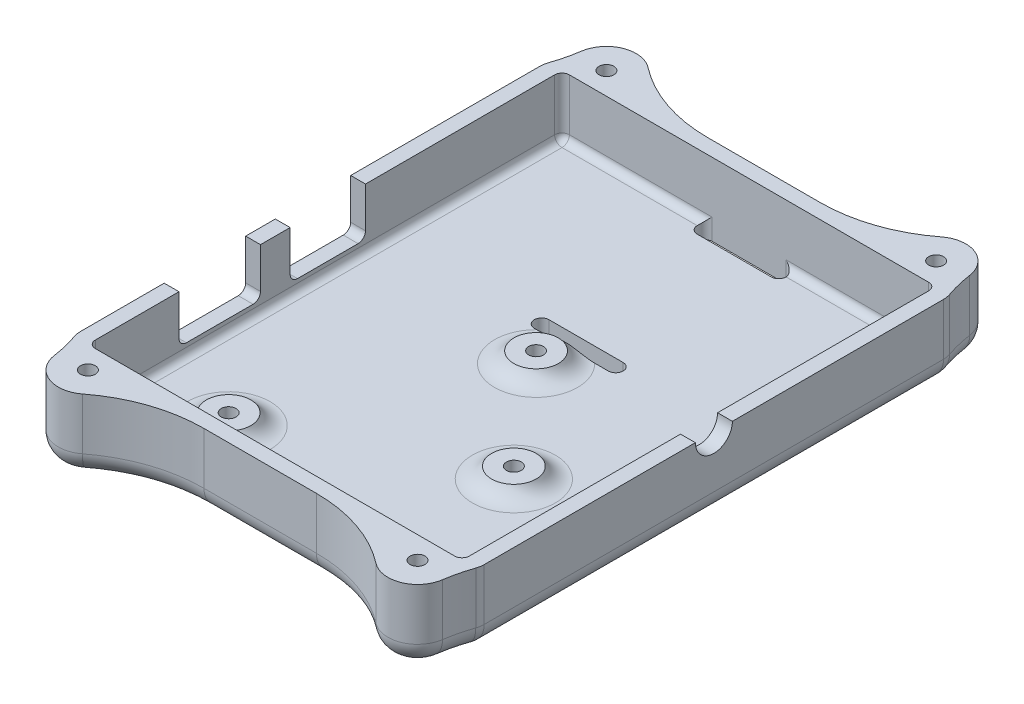
from build123d import *

# Parameters (mm, degrees)
SKETCH1_R           = 1.0000000000000018
SKETCH1_R_2         = 1
CASING_BOTTOM_DEPTH = 2
CASING_WALLS_DEPTH  = 8
FILLET1_R           = 1
BOSS_EXTRUDE3_START = -10
SKETCH3_R           = 0.9999999999999983
SKETCH3_R_2         = 1.0000000000000018
BOSS_EXTRUDE3_DEPTH = 10
FILLET2_R           = 20
FILLET3_R           = 3
SKETCH5_R           = 3.0000000000000027
SKETCH5_R_2         = 1.0000000000000018
SKETCH5_R_3         = 3
SKETCH5_R_4         = 1
BOSS_EXTRUDE4_DEPTH = 1.5
FILLET4_R           = 3
SKETCH6_W           = 10.174002270500015
SKETCH6_H           = 8
CUT_EXTRUDE2_DEPTH  = 2
FILLET5_R           = 1
CUT_EXTRUDE3_DEPTH  = 2


with BuildPart() as part:
    # Sketch1 → Casing bottom (new body)
    with BuildSketch(Plane(origin=(0, 0, 0), x_dir=(1, 0, 0), z_dir=(0, 1, 0))):
        with BuildLine():
            Line((-35.500000000000014, 45.000000000000014), (13.00000000000001, 45.000000000000014))
            ThreePointArc((13.00000000000001, 45.000000000000014), (15.121320343559663, 44.12132034355965), (16.000000000000014, 42))
            Line((16.000000000000014, 42), (16.000000000000007, -19.999999999999996))
            ThreePointArc((16.000000000000007, -19.999999999999996), (15.121320343559653, -22.121320343559645), (13.000000000000005, -23.000000000000004))
            Line((13.000000000000005, -23.000000000000004), (-35.50000000000001, -23.000000000000004))
            ThreePointArc((-35.50000000000001, -23.000000000000004), (-37.62132034355965, -22.12132034355964), (-38.50000000000001, -19.999999999999996))
            Line((-38.50000000000001, -19.999999999999996), (-38.500000000000014, 42))
            ThreePointArc((-38.500000000000014, 42), (-37.62132034355967, 44.12132034355965), (-35.500000000000014, 45.000000000000014))
        make_face()
        with Locations(Location((-25.500000000000004, -13.000000000000002, 0), (0, 0, 270))):
            Circle(SKETCH1_R, mode=Mode.SUBTRACT)
        with Locations(Location((0, 0, 0), (0, 0, 270))):
            Circle(SKETCH1_R_2, mode=Mode.SUBTRACT)
        with Locations(Location((-12, 15, 0), (0, 0, 270))):
            Circle(SKETCH1_R, mode=Mode.SUBTRACT)
        with BuildLine():
            Line((-16.249999999999996, 21.000000000000007), (-6.249999999999996, 21.000000000000007))
            ThreePointArc((-6.249999999999996, 21.000000000000007), (-5.249999999999996, 20.000000000000007), (-6.249999999999996, 19.000000000000007))
            Line((-6.249999999999996, 19.000000000000007), (-16.249999999999996, 19.000000000000007))
            ThreePointArc((-16.249999999999996, 19.000000000000007), (-17.249999999999996, 20.000000000000007), (-16.249999999999996, 21.000000000000007))
        make_face(mode=Mode.SUBTRACT)
        with BuildLine():
            Line((-16.249999999999996, 43.00000000000001), (-6.249999999999996, 43.00000000000001))
            ThreePointArc((-6.249999999999996, 43.00000000000001), (-5.249999999999996, 42.00000000000001), (-6.249999999999996, 41.00000000000001))
            Line((-6.249999999999996, 41.00000000000001), (-16.249999999999996, 41.00000000000001))
            ThreePointArc((-16.249999999999996, 41.00000000000001), (-17.249999999999996, 42.00000000000001), (-16.249999999999996, 43.00000000000001))
        make_face(mode=Mode.SUBTRACT)
    extrude(amount=CASING_BOTTOM_DEPTH)

    # Sketch2 → Casing walls (add)
    with BuildSketch(Plane(origin=(0, 2, 0), x_dir=(1, 0, 0), z_dir=(0, 1, 0))):
        with BuildLine():
            Line((16.000000000000007, -19.999999999999996), (16.000000000000014, 42))
            ThreePointArc((16.000000000000014, 42), (15.121320343559656, 44.121320343559645), (13.00000000000001, 45.000000000000014))
            Line((13.00000000000001, 45.000000000000014), (-35.500000000000014, 45.000000000000014))
            ThreePointArc((-35.500000000000014, 45.000000000000014), (-37.62132034355967, 44.12132034355965), (-38.50000000000002, 42))
            Line((-38.50000000000002, 42), (-38.50000000000001, -19.999999999999996))
            ThreePointArc((-38.50000000000001, -19.999999999999996), (-37.62132034355965, -22.12132034355964), (-35.50000000000001, -23))
            Line((-35.50000000000001, -23), (13.000000000000005, -23.000000000000004))
            ThreePointArc((13.000000000000005, -23.000000000000004), (15.121320343559653, -22.121320343559645), (16.000000000000007, -19.999999999999996))
        make_face()
        with BuildLine():
            ThreePointArc((-36.5, -19.999999999999996), (-36.20710678118655, -20.70710678118654), (-35.50000000000001, -20.999999999999996))
            Line((-35.50000000000001, -20.999999999999996), (13.000000000000009, -20.999999999999996))
            ThreePointArc((13.000000000000009, -20.999999999999996), (13.707106781186557, -20.707106781186543), (14.000000000000007, -19.999999999999996))
            Line((14.000000000000007, -19.999999999999996), (14.000000000000007, 42.00000000000001))
            ThreePointArc((14.000000000000007, 42.00000000000001), (13.707106781186555, 42.70710678118655), (13.000000000000009, 43.00000000000001))
            Line((13.000000000000009, 43.00000000000001), (-35.500000000000014, 43))
            ThreePointArc((-35.500000000000014, 43), (-36.20710678118657, 42.70710678118655), (-36.50000000000002, 42))
            Line((-36.50000000000002, 42), (-36.5, -19.999999999999996))
        make_face(mode=Mode.SUBTRACT)
    extrude(amount=CASING_WALLS_DEPTH)

    # Fillet1
    fillet1_edges = [part.edges().sort_by_distance(p)[0] for p in [
        (-25.875000000000007, 2, -43),
        (-36.20710678118657, 2, -42.70710678118655),
        (-36.20710678118655, 2, 20.707106781186543),
        (-11.25, 2, 20.999999999999996),
        (13.707106781186557, 2, 20.707106781186543),
        (14.000000000000007, 2, -11.000000000000004),
        (13.707106781186555, 2, -42.70710678118655),
        (3.375000000000007, 2, -43.00000000000001),
        (-36.500000000000014, 2, -11),
    ]]
    fillet(fillet1_edges, radius=FILLET1_R)

    # Sketch3 → Boss-Extrude3 (add)
    # profile 1 of 4: a face of its own
    with BuildSketch(Plane(origin=(0, 10, 0), x_dir=(1, 0, 0), z_dir=(0, 1, 0)).offset(BOSS_EXTRUDE3_START)):
        with BuildLine():
            Line((-35.500000000000014, 43), (-30.854248688935428, 43.00000000000001))
            ThreePointArc((-30.854248688935428, 43.00000000000001), (-33.600556679704695, 49.998735844509724), (-35.99161984870957, 42.87080992435478))
            ThreePointArc((-35.99161984870957, 42.87080992435478), (-35.75415553864241, 42.96716335857879), (-35.500000000000014, 43))
        make_face()
        with Locations(Location((-33.500000000000014, 46.000000000000014, 0), (0, 0, 270))):
            Circle(SKETCH3_R, mode=Mode.SUBTRACT)
    # profile 2 of 4: a face of its own
    with BuildSketch(Plane(origin=(0, 10, 0), x_dir=(1, 0, 0), z_dir=(0, 1, 0)).offset(BOSS_EXTRUDE3_START)):
        with BuildLine():
            Line((8.35424868893541, 43.00000000000001), (13.000000000000009, 43.00000000000001))
            ThreePointArc((13.000000000000009, 43.00000000000001), (13.25415553864241, 42.96716335857878), (13.491619848709576, 42.87080992435478))
            ThreePointArc((13.491619848709576, 42.87080992435478), (11.100556679704688, 49.998735844509724), (8.35424868893541, 43.00000000000001))
        make_face()
        with Locations(Location((11.000000000000007, 46.00000000000001, 0), (0, 0, 270))):
            Circle(SKETCH3_R_2, mode=Mode.SUBTRACT)
    # profile 3 of 4: a face of its own
    with BuildSketch(Plane(origin=(0, 10, 0), x_dir=(1, 0, 0), z_dir=(0, 1, 0)).offset(BOSS_EXTRUDE3_START)):
        with BuildLine():
            Line((8.35424868893541, -21.000000000000004), (13.000000000000009, -21.000000000000004))
            ThreePointArc((13.000000000000009, -21.000000000000004), (13.254155538642408, -20.967163358578787), (13.491619848709576, -20.870809924354788))
            ThreePointArc((13.491619848709576, -20.870809924354788), (11.100556679704685, -27.998735844509707), (8.35424868893541, -21.000000000000004))
        make_face()
        with Locations(Location((11.000000000000007, -24, 0), (0, 0, 90))):
            Circle(SKETCH3_R_2, mode=Mode.SUBTRACT)
    # profile 4 of 4: a face of its own
    with BuildSketch(Plane(origin=(0, 10, 0), x_dir=(1, 0, 0), z_dir=(0, 1, 0)).offset(BOSS_EXTRUDE3_START)):
        with BuildLine():
            Line((-35.500000000000014, -20.999999999999996), (-30.854248688935428, -21.000000000000004))
            ThreePointArc((-30.854248688935428, -21.000000000000004), (-33.600556679704695, -27.998735844509717), (-35.99161984870957, -20.870809924354788))
            ThreePointArc((-35.99161984870957, -20.870809924354788), (-35.75415553864241, -20.96716335857878), (-35.500000000000014, -20.999999999999996))
        make_face()
        with Locations(Location((-33.500000000000014, -24.000000000000007, 0), (0, 0, 90))):
            Circle(SKETCH3_R, mode=Mode.SUBTRACT)
    extrude(amount=BOSS_EXTRUDE3_DEPTH)

    # Fillet2
    fillet2_edges = [part.edges().sort_by_distance(p)[0] for p in [
        (-29.627016653792595, 5, -45.000000000000014),
        (-37.19733891886112, 5, -44.47366945943057),
        (14.69733891886112, 5, -44.47366945943056),
        (7.127016653792585, 5, -45.000000000000014),
        (7.127016653792586, 5, 23.000000000000004),
        (14.697338918861105, 5, 22.473669459430557),
        (-37.19733891886111, 5, 22.47366945943055),
        (-29.6270166537926, 5, 23.000000000000004),
    ]]
    fillet(fillet2_edges, radius=FILLET2_R)

    # Fillet3
    # the kernel refuses this fillet: 3 mm, written as the material it takes off along each edge
    with BuildSketch(Plane(origin=(-18.83712170138482, 0, 43), x_dir=(-0.6109532624423001, 0, -0.791666666666666), z_dir=(-0.791666666666666, 0, 0.6109532624423001))) as fillet3_piece_1:
        with BuildLine():
            CenterArc((20.000000000000004 + FILLET3_R, -FILLET3_R), FILLET3_R, 90, 90)
            Line((20.000000000000007, -FILLET3_R), (20.000000000000004, 0))
            Line((20.000000000000004, 0), (20.000000000000004 + FILLET3_R, 0))
        make_face()
    revolve(axis=Axis((-18.83712170138482, 0, 43), (0, -1, 0)), revolution_arc=37.658462006207905, mode=Mode.SUBTRACT)
    with BuildSketch(Plane(origin=(-33.500000000000014, 0, 24.00000000000001), x_dir=(0.6109532624422995, 0, 0.7916666666666664), z_dir=(0.7916666666666664, 0, -0.6109532624422995))) as fillet3_piece_2:
        with BuildLine():
            CenterArc((3.9999999999999982 - FILLET3_R, -FILLET3_R), FILLET3_R, 8.48e-15, 90)
            Line((3.9999999999999982, -FILLET3_R), (3.9999999999999982, 0))
            Line((3.9999999999999982, 0), (3.9999999999999982 - FILLET3_R, 0))
        make_face()
    revolve(axis=Axis((-33.500000000000014, 0, 24.00000000000001), (0, -1, 0)), revolution_arc=119.28031754414539, mode=Mode.SUBTRACT)
    with BuildSketch(Plane(origin=(-57.24387307605734, 0, 27.496936167148185), x_dir=(0.9453857252310887, 0, -0.32595372452127086), z_dir=(-0.32595372452127086, 0, -0.9453857252310887))) as fillet3_piece_3:
        with BuildLine():
            CenterArc((20.00000148352137 + FILLET3_R * 1.00000000214, -FILLET3_R), FILLET3_R, 90, 89.99999999999997)
            Line((20.00000148352137 + FILLET3_R * 2.14146922417e-09, -FILLET3_R), (20.00000148352137, 0))
            Line((20.00000148352137, 0), (20.00000148352137 + FILLET3_R * 1.00000000214, 0))
        make_face()
    revolve(axis=Axis((-57.24387307605734, 0, 27.496936167148185), (0, -1, 0)), revolution_arc=10.645221250007552, mode=Mode.SUBTRACT)
    with BuildSketch(Plane(origin=(-35.5, 0, 19.999999999999993), x_dir=(-0.9453857229785418, 0, 0.32595373105448533), z_dir=(0.32595373105448533, 0, 0.9453857229785418))) as fillet3_piece_4:
        with BuildLine():
            CenterArc((3.0000000000000036 - FILLET3_R, -FILLET3_R), FILLET3_R, 8.48e-15, 90)
            Line((3.0000000000000036, -FILLET3_R), (3.0000000000000036, 0))
            Line((3.0000000000000036, 0), (3.0000000000000036 - FILLET3_R, 0))
        make_face()
    revolve(axis=Axis((-35.5, 0, 19.999999999999993), (0, -1, 0)), revolution_arc=19.023366503969896, mode=Mode.SUBTRACT)
    with BuildSketch(Plane(origin=(-38.50000000000001, 0, 19.999999999999996), x_dir=(1, 0, -1.1e-16), z_dir=(-1.1e-16, 0, -1))) as fillet3_piece_5:
        with BuildLine():
            CenterArc((FILLET3_R, -FILLET3_R), FILLET3_R, 90, 90)
            Line((0, -FILLET3_R), (0, 0))
            Line((0, 0), (FILLET3_R, 0))
        make_face()
    extrude(amount=62, mode=Mode.SUBTRACT)
    with BuildSketch(Plane(origin=(-35.50000000000003, 0, -42.00000000000003), x_dir=(-1, 0, 9.47e-15), z_dir=(9.47e-15, 0, 1))) as fillet3_piece_6:
        with BuildLine():
            CenterArc((2.999999999999986 - FILLET3_R, -FILLET3_R), FILLET3_R, 8.48e-15, 90)
            Line((2.999999999999986, -FILLET3_R), (2.999999999999986, 0))
            Line((2.999999999999986, 0), (2.999999999999986 - FILLET3_R, 0))
        make_face()
    revolve(axis=Axis((-35.50000000000003, 0, -42.00000000000003), (0, -1, 0)), revolution_arc=19.023366503970635, mode=Mode.SUBTRACT)
    with BuildSketch(Plane(origin=(-57.243873076059, 0, -49.49693616714876), x_dir=(0.9893279835141823, 0, 0.14570566576410793), z_dir=(0.14570566576410793, 0, -0.9893279835141823))) as fillet3_piece_7:
        with BuildLine():
            CenterArc((20.000001483523118 + FILLET3_R * 1.00000000214, -FILLET3_R), FILLET3_R, 90, 90)
            Line((20.000001483523118 + FILLET3_R * 2.14147277688e-09, -FILLET3_R), (20.000001483523118, 0))
            Line((20.000001483523118, 0), (20.000001483523118 + FILLET3_R * 1.00000000214, 0))
        make_face()
    revolve(axis=Axis((-57.243873076059, 0, -49.49693616714876), (0, -1, 0)), revolution_arc=10.645221250006543, mode=Mode.SUBTRACT)
    with BuildSketch(Plane(origin=(-33.500000000000014, 0, -46.00000000000001), x_dir=(0.6109532624422982, 0, -0.7916666666666675), z_dir=(0.7916666666666675, 0, 0.6109532624422982))) as fillet3_piece_8:
        with BuildLine():
            CenterArc((4 - FILLET3_R, FILLET3_R), FILLET3_R, 270, 89.99999999999999)
            Line((4, FILLET3_R), (4, 0))
            Line((4, 0), (4 - FILLET3_R, 0))
        make_face()
    revolve(axis=Axis((-33.500000000000014, 0, -46.00000000000001), (0, 1, 0)), revolution_arc=119.28031754414503, mode=Mode.SUBTRACT)
    with BuildSketch(Plane(origin=(-18.837121701384845, 0, -65.00000000000001), x_dir=(1.8e-16, 0, 1), z_dir=(1, 0, -1.8e-16))) as fillet3_piece_9:
        with BuildLine():
            CenterArc((19.999999999999993 + FILLET3_R, -FILLET3_R), FILLET3_R, 90, 90)
            Line((20, -FILLET3_R), (19.999999999999993, 0))
            Line((19.999999999999993, 0), (19.999999999999993 + FILLET3_R, 0))
        make_face()
    revolve(axis=Axis((-18.837121701384845, 0, -65.00000000000001), (0, -1, 0)), revolution_arc=37.658462006207806, mode=Mode.SUBTRACT)
    with BuildSketch(Plane(origin=(-18.837121701384845, 0, -45.000000000000014), x_dir=(0, 0, 1), z_dir=(1, 0, 0))) as fillet3_piece_10:
        with BuildLine():
            CenterArc((FILLET3_R, -FILLET3_R), FILLET3_R, 90, 90)
            Line((0, -FILLET3_R), (0, 0))
            Line((0, 0), (FILLET3_R, 0))
        make_face()
    extrude(amount=15.174243402769676, mode=Mode.SUBTRACT)
    with BuildSketch(Plane(origin=(-3.662878298615171, 0, -65.00000000000001), x_dir=(0.610953262442299, 0, 0.7916666666666667), z_dir=(0.7916666666666667, 0, -0.610953262442299))) as fillet3_piece_11:
        with BuildLine():
            CenterArc((19.999999999999996 + FILLET3_R, -FILLET3_R), FILLET3_R, 90, 90)
            Line((20.00000000000001, -FILLET3_R), (19.999999999999996, 0))
            Line((19.999999999999996, 0), (19.999999999999996 + FILLET3_R, 0))
        make_face()
    revolve(axis=Axis((-3.662878298615171, 0, -65.00000000000001), (0, -1, 0)), revolution_arc=37.65846200620783, mode=Mode.SUBTRACT)
    with BuildSketch(Plane(origin=(11.00000000000001, 0, -46.00000000000001), x_dir=(0.9893279845211018, 0, -0.14570565892721785), z_dir=(0.14570565892721785, 0, 0.9893279845211018))) as fillet3_piece_12:
        with BuildLine():
            CenterArc((4.000000000000008 - FILLET3_R, FILLET3_R), FILLET3_R, 270, 89.99999999999999)
            Line((4.0000000000000036, FILLET3_R), (4.000000000000008, 0))
            Line((4.000000000000008, 0), (4.000000000000008 - FILLET3_R, 0))
        make_face()
    revolve(axis=Axis((11.00000000000001, 0, -46.00000000000001), (0, 1, 0)), revolution_arc=119.28031754414513, mode=Mode.SUBTRACT)
    with BuildSketch(Plane(origin=(34.74387307606069, 0, -49.49693616714912), x_dir=(-0.9453857252310925, 0, 0.32595372452125976), z_dir=(0.32595372452125976, 0, 0.9453857252310925))) as fillet3_piece_13:
        with BuildLine():
            CenterArc((20.000001483524827 + FILLET3_R * 1.00000000214, -FILLET3_R), FILLET3_R, 90, 90)
            Line((20.000001483524827 + FILLET3_R * 2.14147277688e-09, -FILLET3_R), (20.000001483524827, 0))
            Line((20.000001483524827, 0), (20.000001483524827 + FILLET3_R * 1.00000000214, 0))
        make_face()
    revolve(axis=Axis((34.74387307606069, 0, -49.49693616714912), (0, -1, 0)), revolution_arc=10.645221250005626, mode=Mode.SUBTRACT)
    with BuildSketch(Plane(origin=(13.000000000000021, 0, -42.00000000000002), x_dir=(0.9453857229785415, 0, -0.32595373105448605), z_dir=(-0.32595373105448605, 0, -0.9453857229785415))) as fillet3_piece_14:
        with BuildLine():
            CenterArc((2.9999999999999925 - FILLET3_R, -FILLET3_R), FILLET3_R, 8.48e-15, 90)
            Line((2.9999999999999925, -FILLET3_R), (2.9999999999999925, 0))
            Line((2.9999999999999925, 0), (2.9999999999999925 - FILLET3_R, 0))
        make_face()
    revolve(axis=Axis((13.000000000000021, 0, -42.00000000000002), (0, -1, 0)), revolution_arc=19.023366503970404, mode=Mode.SUBTRACT)
    with BuildSketch(Plane(origin=(16.000000000000014, 0, -42), x_dir=(-1, 0, -1.1e-16), z_dir=(-1.1e-16, 0, 1))) as fillet3_piece_15:
        with BuildLine():
            CenterArc((FILLET3_R, -FILLET3_R), FILLET3_R, 90, 90)
            Line((0, -FILLET3_R), (0, 0))
            Line((0, 0), (FILLET3_R, 0))
        make_face()
    extrude(amount=62, mode=Mode.SUBTRACT)
    with BuildSketch(Plane(origin=(13.000000000000014, 0, 20.000000000000007), x_dir=(1, 0, -3.55e-15), z_dir=(-3.55e-15, 0, -1))) as fillet3_piece_16:
        with BuildLine():
            CenterArc((2.9999999999999964 - FILLET3_R, -FILLET3_R), FILLET3_R, 8.48e-15, 90)
            Line((2.9999999999999964, -FILLET3_R), (2.9999999999999964, 0))
            Line((2.9999999999999964, 0), (2.9999999999999964 - FILLET3_R, 0))
        make_face()
    revolve(axis=Axis((13.000000000000014, 0, 20.000000000000007), (0, -1, 0)), revolution_arc=19.023366503970454, mode=Mode.SUBTRACT)
    with BuildSketch(Plane(origin=(34.74387307605885, 0, 27.496936167148768), x_dir=(-0.989327983514182, 0, -0.14570566576410904), z_dir=(-0.14570566576410904, 0, 0.989327983514182))) as fillet3_piece_17:
        with BuildLine():
            CenterArc((20.000001483522976 + FILLET3_R * 1.00000000214, -FILLET3_R), FILLET3_R, 90, 90)
            Line((20.000001483522976 + FILLET3_R * 2.14147040841e-09, -FILLET3_R), (20.000001483522976, 0))
            Line((20.000001483522976, 0), (20.000001483522976 + FILLET3_R * 1.00000000214, 0))
        make_face()
    revolve(axis=Axis((34.74387307605885, 0, 27.496936167148768), (0, -1, 0)), revolution_arc=10.645221250006648, mode=Mode.SUBTRACT)
    with BuildSketch(Plane(origin=(11.000000000000002, 0, 24), x_dir=(0.9893279845211012, 0, 0.14570565892722168), z_dir=(0.14570565892722168, 0, -0.9893279845211012))) as fillet3_piece_18:
        with BuildLine():
            CenterArc((3.999999999999997 - FILLET3_R, -FILLET3_R), FILLET3_R, 8.48e-15, 90)
            Line((3.9999999999999987, -FILLET3_R), (3.999999999999997, 0))
            Line((3.999999999999997, 0), (3.999999999999997 - FILLET3_R, 0))
        make_face()
    revolve(axis=Axis((11.000000000000002, 0, 24), (0, -1, 0)), revolution_arc=119.280317544145, mode=Mode.SUBTRACT)
    with BuildSketch(Plane(origin=(-3.662878298615178, 0, 43), x_dir=(0, 0, -1), z_dir=(-1, 0, 0))) as fillet3_piece_19:
        with BuildLine():
            CenterArc((20 + FILLET3_R, -FILLET3_R), FILLET3_R, 90, 90)
            Line((20, -FILLET3_R), (20, 0))
            Line((20, 0), (20 + FILLET3_R, 0))
        make_face()
    revolve(axis=Axis((-3.662878298615178, 0, 43), (0, -1, 0)), revolution_arc=37.65846200620784, mode=Mode.SUBTRACT)
    with BuildSketch(Plane(origin=(-3.662878298615178, 0, 23.000000000000004), x_dir=(0, 0, -1), z_dir=(-1, 0, 0))) as fillet3_piece_20:
        with BuildLine():
            CenterArc((FILLET3_R, -FILLET3_R), FILLET3_R, 90, 90)
            Line((0, -FILLET3_R), (0, 0))
            Line((0, 0), (FILLET3_R, 0))
        make_face()
    extrude(amount=15.174243402769639, mode=Mode.SUBTRACT)

    # Sketch5 → Boss-Extrude4 (add)
    # profile 1 of 3: a face of its own
    with BuildSketch(Plane(origin=(0, 2, 0), x_dir=(1, 0, 0), z_dir=(0, 1, 0))):
        with Locations(Location((-25.500000000000004, -13.000000000000002, 0), (0, 0, 90))):
            Circle(SKETCH5_R)
        with Locations(Location((-25.500000000000004, -13.000000000000002, 0), (0, 0, 270))):
            Circle(SKETCH5_R_2, mode=Mode.SUBTRACT)
    # profile 2 of 3: a face of its own
    with BuildSketch(Plane(origin=(0, 2, 0), x_dir=(1, 0, 0), z_dir=(0, 1, 0))):
        with Locations(Location((0, 0, 0), (0, 0, 90))):
            Circle(SKETCH5_R_3)
        with Locations(Location((0, 0, 0), (0, 0, 270))):
            Circle(SKETCH5_R_4, mode=Mode.SUBTRACT)
    # profile 3 of 3: a face of its own
    with BuildSketch(Plane(origin=(0, 2, 0), x_dir=(1, 0, 0), z_dir=(0, 1, 0))):
        with Locations(Location((-12, 15, 0), (0, 0, 90))):
            Circle(SKETCH5_R)
        with Locations(Location((-12, 15, 0), (0, 0, 270))):
            Circle(SKETCH5_R_2, mode=Mode.SUBTRACT)
    extrude(amount=BOSS_EXTRUDE4_DEPTH)

    # Fillet4
    # the kernel refuses this fillet: 3 mm, written as the material it adds along each edge
    with BuildSketch(Plane(origin=(-25.500000000000004, 2, 13.000000000000002), x_dir=(0, 0, -1), z_dir=(1, 0, 0))) as fillet4_piece_1:
        with BuildLine():
            CenterArc((5.5980762113534634, 3), FILLET4_R, 209.9999999999986, 60.000000000001364)
            Line((3.000000000000112, 1.500000000000063), (2.9480384757730445, 1.4700000000000641))
            ThreePointArc((2.9480384757730445, 1.4700000000000641), (2.9400000000000013, 0.7500000000000315), (2.9400000000000013, 0))
            Line((2.9400000000000013, 0), (3.0000000000000018, -0.06000000000000005))
            Line((3.0000000000000018, -0.06000000000000005), (5.5980762113534634, -0.06000000000000005))
            Line((5.5980762113534634, -0.06000000000000005), (5.5980762113534634, 0))
        make_face()
    revolve(axis=Axis((-25.500000000000004, 2, 13.000000000000002), (0, 1, 0)))
    with BuildSketch(Plane(origin=(0, 2, 0), x_dir=(6e-17, 0, -1), z_dir=(1, 0, 6e-17))) as fillet4_piece_2:
        with BuildLine():
            CenterArc((5.598076211353462, 3), FILLET4_R, 209.99999999999858, 60.00000000000142)
            Line((3.0000000000001092, 1.500000000000063), (2.9480384757730422, 1.4700000000000641))
            ThreePointArc((2.9480384757730422, 1.4700000000000641), (2.94, 0.7500000000000315), (2.94, 0))
            Line((2.94, 0), (3, -0.06000000000000005))
            Line((3, -0.06000000000000005), (5.598076211353462, -0.06000000000000005))
            Line((5.598076211353462, -0.06000000000000005), (5.598076211353462, 0))
        make_face()
    revolve(axis=Axis((0, 2, 0), (0, 1, 0)))
    with BuildSketch(Plane(origin=(-12, 2, -15), x_dir=(0, 0, -1), z_dir=(1, 0, 0))) as fillet4_piece_3_section:
        with BuildLine():
            CenterArc((5.598076211353469, 3), FILLET4_R, 209.99999999999855, 60.00000000000148)
            Line((3.0000000000001137, 1.5000000000000648), (2.9480384757730462, 1.470000000000066))
            ThreePointArc((2.9480384757730462, 1.470000000000066), (2.940000000000005, 0.7500000000000324), (2.940000000000005, 0))
            Line((2.940000000000005, 0), (3.0000000000000036, -0.06000000000000005))
            Line((3.0000000000000036, -0.06000000000000005), (5.598076211353469, -0.06000000000000005))
            Line((5.598076211353469, -0.06000000000000005), (5.598076211353469, 0))
        make_face()
    fillet4_piece_3 = revolve(axis=Axis((-12, 2, -15), (0, 1, 0)), mode=Mode.PRIVATE)
    fillet4_piece_3 = split(fillet4_piece_3, bisect_by=Plane(origin=(-12, 2, -19.000000000000007), z_dir=(0, 0, 1)), keep=Keep.TOP, mode=Mode.PRIVATE)
    add(fillet4_piece_3)

    # Sketch6 → Cut-Extrude2 (cut)
    with BuildSketch(Plane.ZY.offset(38.50000000000001)):
        with Locations((-11.386001467976088, 7.53148)):
            Rectangle(SKETCH6_W, SKETCH6_H)
        Polygon((-2.2990003327260853, 10), (8.700999667273914, 10), (8.700999667273914, 3.53148), (-2.2990003327260817, 3.53148), align=None)
    extrude(amount=-CUT_EXTRUDE2_DEPTH, mode=Mode.SUBTRACT)

    # Fillet5
    fillet5_edges = [part.edges().sort_by_distance(p)[0] for p in [
        (-37.50000000000001, 3.53148, -16.473002603226092),
        (-37.50000000000001, 3.53148, -6.299000332726077),
        (-37.50000000000001, 3.53148, -2.2990003327260773),
        (-37.50000000000001, 3.53148, 8.700999667273917),
    ]]
    fillet(fillet5_edges, radius=FILLET5_R)

    # Sketch7 → Cut-Extrude3 (cut)
    with BuildSketch(Plane(origin=(16.00000000000001, 0, 1.79e-15), x_dir=(1.1e-16, 0, -1), z_dir=(1, 0, 1.1e-16))):
        with BuildLine():
            Line((8.500000000000004, 10), (13.500000000000005, 10))
            ThreePointArc((13.500000000000005, 10), (11.000000000000007, 7.4999999999999964), (8.500000000000004, 10))
        make_face()
    extrude(amount=-CUT_EXTRUDE3_DEPTH, mode=Mode.SUBTRACT)


solid = part.part
